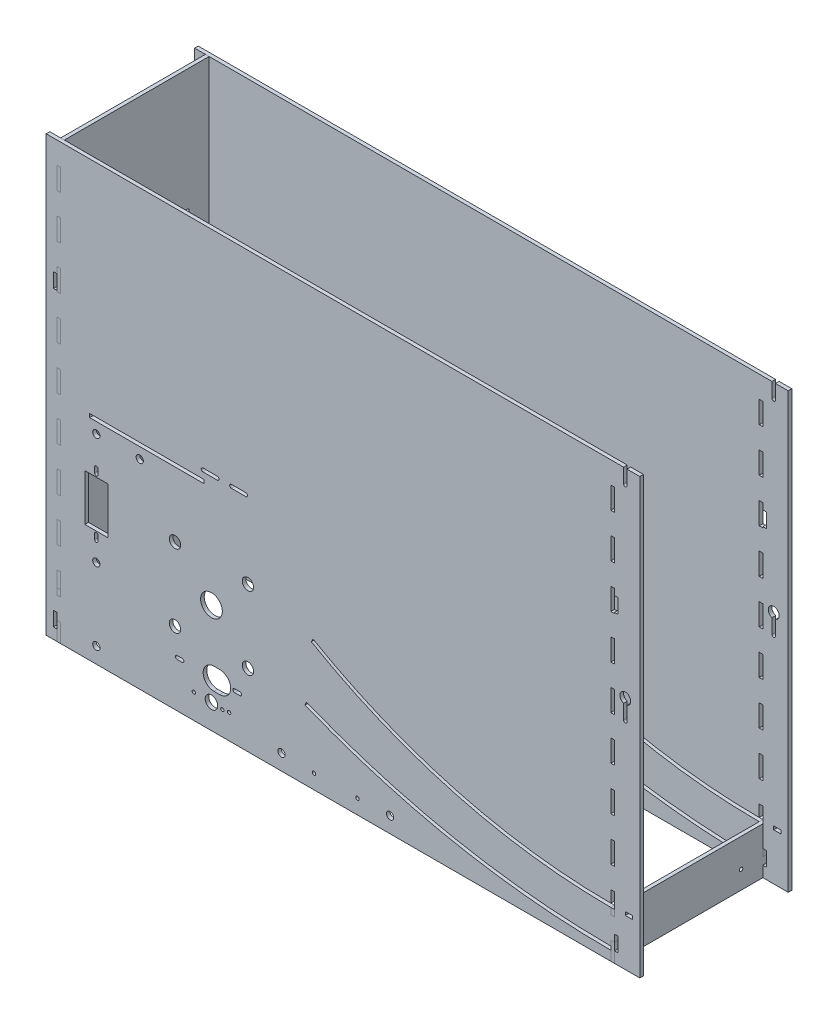
from build123d import *

# Parameters (mm, degrees)
SKETCH1_W                      = 488.95
SKETCH1_H                      = 133.35
SKETCH1_W_2                    = 482.6
SKETCH1_H_2                    = 127
BASE_EXTRUDE_DEPTH             = 3.175
SKETCH1_3_W                    = 488.95
SKETCH1_3_H                    = 133.35
SKETCH1_3_W_2                  = 482.6
SKETCH1_3_H_2                  = 127
WALL_EXTRUDE_DEPTH             = 384.175
WHEELRAMP7_W                   = 100.522513305
WHEELRAMP7_H                   = 3.175
WHEELRAMP7_R                   = 9.525
WHEELRAMP7_R_2                 = 5
CUT_EXTRUDE6_DEPTH             = 475.489914276
WHEELRAMP7_3_W                 = 20.2
WHEELRAMP7_3_H                 = 40.9
BRAKE_PAD_SERVO_CUT_DEPTH      = 475.489914276
WHEELRAMP7_4_R                 = 1.5
RATCHET_BRAKE_SERVO_CUT_DEPTH  = 475.489914276
WHEELRAMP7_5_R                 = 5.5
WHEELRAMP7_5_R_2               = 1.5
SOLENOIDBRAKE_DEPTH            = 475.489914276
SKETCH19_W                     = 25.4
SKETCH19_H                     = 3.175
SKETCH19_R                     = 3.175
SKETCH19_R_2                   = 5.5
SKETCH19_R_3                   = 1.5
SIDE_CUTS_DEPTH                = 626.386351586
SKETCH23_W                     = 6.35
SKETCH23_H                     = 2.9972
SKETCH23_W_2                   = 9.525
SKETCH23_H_2                   = 384.175
BOSS_EXTRUDE1_DEPTH            = 3.175
BOSS_EXTRUDE2_START            = -130.175
SKETCH23_2_W                   = 6.35
SKETCH23_2_H                   = 2.9972
SKETCH23_2_W_2                 = 9.525
SKETCH23_2_H_2                 = 384.175
BOSS_EXTRUDE2_DEPTH            = 3.175
SKETCH21_W                     = 12.827
SKETCH21_H                     = 6.477
SKETCH21_W_2                   = 6.477
SKETCH21_H_2                   = 12.827
SKETCH21_W_3                   = 3.175
BOTTOM_SUPPORT_HOLES_DEPTH     = 473.403298306
SPLIT1_START                   = -63.5
SPLIT1_OUTLINE_W               = 3.175
SPLIT1_OUTLINE_H               = 40.973335237
SPLIT1_DEPTH                   = 127
SPLIT1_START_2                 = -66.675
SPLIT1_2_OUTLINE_W             = 3.175
SPLIT1_2_OUTLINE_H             = 16.03375
SPLIT1_2_OUTLINE_H_2           = 5.730835237
SPLIT1_2_DEPTH                 = 133.35
SPLIT1_3_OUTLINE_W             = 3.175
SPLIT1_3_OUTLINE_H             = 3.175
SPLIT1_3_DEPTH                 = 12.122727273
SPLIT1_START_3                 = -42.429545455
SPLIT1_4_OUTLINE_W             = 3.175
SPLIT1_4_OUTLINE_H             = 3.175
SPLIT1_4_DEPTH                 = 12.122727273
SPLIT1_START_4                 = -18.184090909
SPLIT1_5_OUTLINE_W             = 3.175
SPLIT1_5_OUTLINE_H             = 3.175
SPLIT1_5_DEPTH                 = 12.122727273
SPLIT1_START_5                 = 6.061363636
SPLIT1_6_OUTLINE_W             = 3.175
SPLIT1_6_OUTLINE_H             = 3.175
SPLIT1_6_DEPTH                 = 12.122727273
SPLIT1_START_6                 = 30.306818182
SPLIT1_7_OUTLINE_W             = 3.175
SPLIT1_7_OUTLINE_H             = 3.175
SPLIT1_7_DEPTH                 = 12.122727273
SPLIT1_START_7                 = 54.552272727
SPLIT1_8_OUTLINE_W             = 3.175
SPLIT1_8_OUTLINE_H             = 3.175
SPLIT1_8_DEPTH                 = 12.122727273
SPLIT1_START_8                 = -244.475
SPLIT1_9_OUTLINE_R             = 1.5
SPLIT1_9_OUTLINE_R_2           = 5.5
SPLIT1_9_OUTLINE_W             = 3.175
SPLIT1_9_OUTLINE_H             = 25.4
SPLIT1_9_OUTLINE_R_3           = 3.175
SPLIT1_9_DEPTH                 = 3.175
SPLIT1_START_9                 = 3.175
SPLIT1_10_OUTLINE_W            = 3.175
SPLIT1_10_OUTLINE_H            = 127
SPLIT1_10_DEPTH                = 381
SPLIT1_11_OUTLINE_W            = 3.175
SPLIT1_11_OUTLINE_H            = 12.122727273
SPLIT1_11_DEPTH                = 19.20875
SPLIT1_START_10                = 38.4175
SPLIT1_12_OUTLINE_W            = 3.175
SPLIT1_12_OUTLINE_H            = 3.175
SPLIT1_12_DEPTH                = 19.20875
SPLIT1_START_11                = 76.835
SPLIT1_13_OUTLINE_W            = 3.175
SPLIT1_13_OUTLINE_H            = 3.175
SPLIT1_13_DEPTH                = 19.20875
SPLIT1_START_12                = 115.2525
SPLIT1_14_OUTLINE_W            = 3.175
SPLIT1_14_OUTLINE_H            = 3.175
SPLIT1_14_DEPTH                = 19.20875
SPLIT1_START_13                = 153.67
SPLIT1_15_OUTLINE_W            = 3.175
SPLIT1_15_OUTLINE_H            = 3.175
SPLIT1_15_DEPTH                = 19.20875
SPLIT1_START_14                = 192.0875
SPLIT1_16_OUTLINE_W            = 3.175
SPLIT1_16_OUTLINE_H            = 3.175
SPLIT1_16_DEPTH                = 19.20875
SPLIT1_START_15                = 230.505
SPLIT1_17_OUTLINE_W            = 3.175
SPLIT1_17_OUTLINE_H            = 3.175
SPLIT1_17_DEPTH                = 19.20875
SPLIT1_START_16                = 268.9225
SPLIT1_18_OUTLINE_W            = 3.175
SPLIT1_18_OUTLINE_H            = 3.175
SPLIT1_18_DEPTH                = 19.20875
SPLIT1_START_17                = 307.34
SPLIT1_19_OUTLINE_W            = 3.175
SPLIT1_19_OUTLINE_H            = 3.175
SPLIT1_19_DEPTH                = 19.20875
SPLIT1_START_18                = 345.7575
SPLIT1_20_OUTLINE_W            = 3.175
SPLIT1_20_OUTLINE_H            = 3.175
SPLIT1_20_DEPTH                = 19.20875
SPLIT2_START                   = -63.5
SPLIT2_OUTLINE_W               = 3.175
SPLIT2_OUTLINE_H               = 40.973335237
SPLIT2_DEPTH                   = 127
SPLIT2_START_2                 = -66.675
SPLIT2_2_OUTLINE_W             = 3.175
SPLIT2_2_OUTLINE_H             = 16.03375
SPLIT2_2_OUTLINE_H_2           = 5.730835237
SPLIT2_2_DEPTH                 = 133.35
SPLIT2_3_OUTLINE_W             = 3.175
SPLIT2_3_OUTLINE_H             = 3.175
SPLIT2_3_DEPTH                 = 12.122727273
SPLIT2_START_3                 = -42.429545455
SPLIT2_4_OUTLINE_W             = 3.175
SPLIT2_4_OUTLINE_H             = 3.175
SPLIT2_4_DEPTH                 = 12.122727273
SPLIT2_START_4                 = -18.184090909
SPLIT2_5_OUTLINE_W             = 3.175
SPLIT2_5_OUTLINE_H             = 3.175
SPLIT2_5_DEPTH                 = 12.122727273
SPLIT2_START_5                 = 6.061363636
SPLIT2_6_OUTLINE_W             = 3.175
SPLIT2_6_OUTLINE_H             = 3.175
SPLIT2_6_DEPTH                 = 12.122727273
SPLIT2_START_6                 = 30.306818182
SPLIT2_7_OUTLINE_W             = 3.175
SPLIT2_7_OUTLINE_H             = 3.175
SPLIT2_7_DEPTH                 = 12.122727273
SPLIT2_START_7                 = 54.552272727
SPLIT2_8_OUTLINE_W             = 3.175
SPLIT2_8_OUTLINE_H             = 3.175
SPLIT2_8_DEPTH                 = 12.122727273
SPLIT2_START_8                 = 3.175
SPLIT2_9_OUTLINE_W             = 3.175
SPLIT2_9_OUTLINE_H             = 127
SPLIT2_9_DEPTH                 = 381
SPLIT2_10_OUTLINE_W            = 3.175
SPLIT2_10_OUTLINE_H            = 12.122727273
SPLIT2_10_DEPTH                = 19.20875
SPLIT2_START_9                 = 38.4175
SPLIT2_11_OUTLINE_W            = 3.175
SPLIT2_11_OUTLINE_H            = 3.175
SPLIT2_11_DEPTH                = 19.20875
SPLIT2_START_10                = 76.835
SPLIT2_12_OUTLINE_W            = 3.175
SPLIT2_12_OUTLINE_H            = 3.175
SPLIT2_12_DEPTH                = 19.20875
SPLIT2_START_11                = 115.2525
SPLIT2_13_OUTLINE_W            = 3.175
SPLIT2_13_OUTLINE_H            = 3.175
SPLIT2_13_DEPTH                = 19.20875
SPLIT2_START_12                = 153.67
SPLIT2_14_OUTLINE_W            = 3.175
SPLIT2_14_OUTLINE_H            = 3.175
SPLIT2_14_DEPTH                = 19.20875
SPLIT2_START_13                = 192.0875
SPLIT2_15_OUTLINE_W            = 3.175
SPLIT2_15_OUTLINE_H            = 3.175
SPLIT2_15_DEPTH                = 19.20875
SPLIT2_START_14                = 230.505
SPLIT2_16_OUTLINE_W            = 3.175
SPLIT2_16_OUTLINE_H            = 3.175
SPLIT2_16_DEPTH                = 19.20875
SPLIT2_START_15                = 268.9225
SPLIT2_17_OUTLINE_W            = 3.175
SPLIT2_17_OUTLINE_H            = 3.175
SPLIT2_17_DEPTH                = 19.20875
SPLIT2_START_16                = 307.34
SPLIT2_18_OUTLINE_W            = 3.175
SPLIT2_18_OUTLINE_H            = 3.175
SPLIT2_18_DEPTH                = 19.20875
SPLIT2_START_17                = 345.7575
SPLIT2_19_OUTLINE_W            = 3.175
SPLIT2_19_OUTLINE_H            = 3.175
SPLIT2_19_DEPTH                = 19.20875
SPLIT2_START_18                = 241.3
SPLIT2_20_OUTLINE_R            = 1.5
SPLIT2_20_OUTLINE_R_2          = 5.5
SPLIT2_20_OUTLINE_W            = 3.175
SPLIT2_20_OUTLINE_H            = 25.4
SPLIT2_20_OUTLINE_R_3          = 3.175
SPLIT2_20_DEPTH                = 3.175
SKETCH22_W                     = 520.7
SKETCH22_H                     = 3.175
CUT_EXTRUDE5_DEPTH             = 487.314243185
SKETCH26_R                     = 1.5
SKETCH26_W                     = 3.175
SKETCH26_H                     = 12.7
FRONT_BACK_SUPPORT_HOLES_DEPTH = 487.314243185
SKETCH27_R                     = 1.5
SIDE_SUPPORT_HOLES_DEPTH       = 643.9120211
SHORTSIDECUT_START             = -3.175
SHORTSIDECUT_OUTLINE_R         = 1.5
SHORTSIDECUT_OUTLINE_R_2       = 5.5
SHORTSIDECUT_OUTLINE_W         = 25.4
SHORTSIDECUT_OUTLINE_H         = 3.175
SHORTSIDECUT_OUTLINE_R_3       = 3.175
SHORTSIDECUT_DEPTH             = 3.175
WHEELRAMP7_6_R                 = 3.175
WIREHOLECUT_DEPTH              = 487.314243185


# Read off the part's stored shape, not the designer's step: Split1, Split2, ShortSideCut
with BuildPart() as part:
    # Sketch1 → Base Extrude (new body)
    # profile 1 of 2: a face of its own
    with BuildSketch(Plane(origin=(0, 0, 0), x_dir=(1, 0, 0), z_dir=(0, 1, 0))):
        Rectangle(SKETCH1_W, SKETCH1_H)
        Rectangle(SKETCH1_W_2, SKETCH1_H_2, mode=Mode.SUBTRACT)
    # profile 2 of 2: a face of its own
    with BuildSketch(Plane(origin=(0, 0, 0), x_dir=(1, 0, 0), z_dir=(0, 1, 0))):
        Rectangle(SKETCH1_W_2, SKETCH1_H_2)
    extrude(amount=BASE_EXTRUDE_DEPTH)

    # Sketch1<3> → Wall Extrude (add)
    with BuildSketch(Plane(origin=(0, 0, 0), x_dir=(1, 0, 0), z_dir=(0, 1, 0))):
        Rectangle(SKETCH1_3_W, SKETCH1_3_H)
        Rectangle(SKETCH1_3_W_2, SKETCH1_3_H_2, mode=Mode.SUBTRACT)
    extrude(amount=WALL_EXTRUDE_DEPTH)

    # WheelRamp7 → Cut-Extrude6 (cut, through all)
    with BuildSketch(Plane.XY.offset(66.675)):
        with BuildLine():
            Line((-19.862553934, 117.301630657), (-21.450053934, 114.552))
            ThreePointArc((-21.450053934, 114.552), (105.29056388, 62.054317198), (241.3, 44.148335237))
            Line((241.3, 44.148335237), (241.3, 47.323335237))
            ThreePointArc((241.3, 47.323335237), (106.112314349, 65.121131696), (-19.862553934, 117.301630657))
        make_face()
        with Locations((-165.638743347, 189.1665)):
            Rectangle(WHEELRAMP7_W, WHEELRAMP7_H)
        with BuildLine():
            Line((-103.827486695, 199.079), (-116.527486695, 199.079))
            ThreePointArc((-116.527486695, 199.079), (-118.027486695, 197.579), (-116.527486695, 196.079))
            Line((-116.527486695, 196.079), (-103.827486695, 196.079))
            ThreePointArc((-103.827486695, 196.079), (-102.327486695, 197.579), (-103.827486695, 199.079))
        make_face()
        with BuildLine():
            Line((-78.827486695, 199.079), (-91.527486695, 199.079))
            ThreePointArc((-91.527486695, 199.079), (-93.027486695, 197.579), (-91.527486695, 196.079))
            Line((-91.527486695, 196.079), (-78.827486695, 196.079))
            ThreePointArc((-78.827486695, 196.079), (-77.327486695, 197.579), (-78.827486695, 199.079))
        make_face()
        with BuildLine():
            Line((-25.734108325, 66.638172527), (-26.923484259, 63.694363788))
            ThreePointArc((-26.923484259, 63.694363788), (104.678129303, 24.712189892), (241.3, 11.557))
            Line((241.3, 11.557), (241.3, 14.732))
            ThreePointArc((241.3, 14.732), (105.283947863, 27.8288562), (-25.734108325, 66.638172527))
        make_face()
        with Locations((-109.027486695, 98.552)):
            Circle(WHEELRAMP7_R)
        with Locations((-141.027486695, 130.552)):
            Circle(WHEELRAMP7_R_2)
        with Locations((-77.027486695, 130.552)):
            Circle(WHEELRAMP7_R_2)
        with Locations((-141.027486695, 66.552)):
            Circle(WHEELRAMP7_R_2)
        with Locations((-77.027486695, 66.552)):
            Circle(WHEELRAMP7_R_2)
    extrude(amount=-CUT_EXTRUDE6_DEPTH, mode=Mode.SUBTRACT)

    # WheelRamp7<3> → Brake Pad Servo Cut (cut, through all)
    with BuildSketch(Plane.XY.offset(66.675)):
        with Locations((-210.035686695, 124.7948)):
            Rectangle(WHEELRAMP7_3_W, WHEELRAMP7_3_H)
        with BuildLine():
            Line((-211.535686695, 101.7948), (-211.535686695, 97.2948))
            ThreePointArc((-211.535686695, 97.2948), (-210.035686695, 95.7948), (-208.535686695, 97.2948))
            Line((-208.535686695, 97.2948), (-208.535686695, 101.7948))
            ThreePointArc((-208.535686695, 101.7948), (-210.035686695, 103.2948), (-211.535686695, 101.7948))
        make_face()
        with BuildLine():
            Line((-208.535686695, 147.7948), (-208.535686695, 152.2948))
            ThreePointArc((-208.535686695, 152.2948), (-210.035686695, 153.7948), (-211.535686695, 152.2948))
            Line((-211.535686695, 152.2948), (-211.535686695, 147.7948))
            ThreePointArc((-211.535686695, 147.7948), (-210.035686695, 146.2948), (-208.535686695, 147.7948))
        make_face()
    extrude(amount=-BRAKE_PAD_SERVO_CUT_DEPTH, mode=Mode.SUBTRACT)

    # WheelRamp7<4> → Ratchet Brake Servo Cut (cut, through all)
    with BuildSketch(Plane.XY.offset(66.675)):
        with Locations((-99.502486695, 24.0114074)):
            Circle(WHEELRAMP7_4_R)
        with BuildLine():
            Line((-101.697486695, 34.227), (-106.777486695, 34.227))
            ThreePointArc((-106.777486695, 34.227), (-116.302486695, 43.752), (-106.777486695, 53.277))
            Line((-106.777486695, 53.277), (-101.697486695, 53.277))
            ThreePointArc((-101.697486695, 53.277), (-92.172486695, 43.752), (-101.697486695, 34.227))
        make_face()
        with BuildLine():
            Line((-139.187486695, 45.252), (-134.687486695, 45.252))
            ThreePointArc((-134.687486695, 45.252), (-133.187486695, 43.752), (-134.687486695, 42.252))
            Line((-134.687486695, 42.252), (-139.187486695, 42.252))
            ThreePointArc((-139.187486695, 42.252), (-140.687486695, 43.752), (-139.187486695, 45.252))
        make_face()
        with BuildLine():
            Line((-84.187486695, 42.252), (-88.687486695, 42.252))
            ThreePointArc((-88.687486695, 42.252), (-90.187486695, 43.752), (-88.687486695, 45.252))
            Line((-88.687486695, 45.252), (-84.187486695, 45.252))
            ThreePointArc((-84.187486695, 45.252), (-82.687486695, 43.752), (-84.187486695, 42.252))
        make_face()
    extrude(amount=-RATCHET_BRAKE_SERVO_CUT_DEPTH, mode=Mode.SUBTRACT)

    # WheelRamp7<5> → SolenoidBrake (cut, through all)
    with BuildSketch(Plane.XY.offset(66.675)):
        with Locations((-109.027486695, 24.765)):
            Circle(WHEELRAMP7_5_R)
        with Locations((-124.527486695, 24.765)):
            Circle(WHEELRAMP7_5_R_2)
        with Locations((-93.527486695, 24.765)):
            Circle(WHEELRAMP7_5_R_2)
    extrude(amount=-SOLENOIDBRAKE_DEPTH, mode=Mode.SUBTRACT)

    # Sketch19 → Side Cuts (cut, through all)
    with BuildSketch(Plane.ZY.offset(244.475)):
        with Locations((0, 189.1665)):
            Rectangle(SKETCH19_W, SKETCH19_H)
        with Locations((0, 204.216)):
            Circle(SKETCH19_R)
        with Locations((0, 98.552)):
            Circle(SKETCH19_R_2)
        with Locations((-15.5, 98.552)):
            Circle(SKETCH19_R_3)
        with Locations((15.5, 98.552)):
            Circle(SKETCH19_R_3)
    extrude(amount=-SIDE_CUTS_DEPTH, mode=Mode.SUBTRACT)

    # Sketch23 → Boss-Extrude1 (add)
    # profile 1 of 2: a face of its own
    with BuildSketch(Plane.XY.offset(66.675)):
        with BuildLine():
            Line((252.5, 384.175), (244.475, 384.175))
            Line((244.475, 384.175), (244.475, 0))
            Line((244.475, 0), (266.7, 0))
            Line((266.7, 0), (266.7, 384.175))
            Line((266.7, 384.175), (255.5, 384.175))
            Line((255.5, 384.175), (255.5, 371.475))
            ThreePointArc((255.5, 371.475), (254, 369.975), (252.5, 371.475))
            Line((252.5, 371.475), (252.5, 384.175))
        make_face()
        with Locations((257.175, 45.824735237)):
            Rectangle(SKETCH23_W, SKETCH23_H, mode=Mode.SUBTRACT)
        with BuildLine():
            Line((252.5, 192.0875), (252.5, 204.7875))
            ThreePointArc((252.5, 204.7875), (251.212738239, 213.169292048), (258.7625, 209.307611309))
            ThreePointArc((258.7625, 209.307611309), (257.861680738, 206.520349548), (255.5, 204.7875))
            Line((255.5, 204.7875), (255.5, 192.0875))
            ThreePointArc((255.5, 192.0875), (254, 190.5875), (252.5, 192.0875))
        make_face(mode=Mode.SUBTRACT)
    # profile 2 of 2: a face of its own
    with BuildSketch(Plane.XY.offset(66.675)):
        with Locations((-249.2375, 192.0875)):
            Rectangle(SKETCH23_W_2, SKETCH23_H_2)
    extrude(amount=-BOSS_EXTRUDE1_DEPTH)

    # Sketch23<2> → Boss-Extrude2 (add)
    # profile 1 of 2: a face of its own
    with BuildSketch(Plane.XY.offset(66.675).offset(BOSS_EXTRUDE2_START)):
        with BuildLine():
            Line((252.5, 384.175), (244.475, 384.175))
            Line((244.475, 384.175), (244.475, 0))
            Line((244.475, 0), (266.7, 0))
            Line((266.7, 0), (266.7, 384.175))
            Line((266.7, 384.175), (255.5, 384.175))
            Line((255.5, 384.175), (255.5, 371.475))
            ThreePointArc((255.5, 371.475), (254, 369.975), (252.5, 371.475))
            Line((252.5, 371.475), (252.5, 384.175))
        make_face()
        with Locations((257.175, 45.824735237)):
            Rectangle(SKETCH23_2_W, SKETCH23_2_H, mode=Mode.SUBTRACT)
        with BuildLine():
            Line((252.5, 192.0875), (252.5, 204.7875))
            ThreePointArc((252.5, 204.7875), (251.212738239, 213.169292048), (258.7625, 209.307611309))
            ThreePointArc((258.7625, 209.307611309), (257.861680738, 206.520349548), (255.5, 204.7875))
            Line((255.5, 204.7875), (255.5, 192.0875))
            ThreePointArc((255.5, 192.0875), (254, 190.5875), (252.5, 192.0875))
        make_face(mode=Mode.SUBTRACT)
    # profile 2 of 2: a face of its own
    with BuildSketch(Plane.XY.offset(66.675).offset(BOSS_EXTRUDE2_START)):
        with Locations((-249.2375, 192.0875)):
            Rectangle(SKETCH23_2_W_2, SKETCH23_2_H_2)
    extrude(amount=-BOSS_EXTRUDE2_DEPTH)

    # Sketch21 → Bottom Support Holes (cut, through all)
    with BuildSketch(Plane.XZ):
        with Locations((0, 50.7365)):
            Rectangle(SKETCH21_W, SKETCH21_H)
        with Locations((-228.5365, 0)):
            Rectangle(SKETCH21_W_2, SKETCH21_H_2)
        with Locations((0, -50.7365)):
            Rectangle(SKETCH21_W, SKETCH21_H)
        with Locations((230.1875, 0)):
            Rectangle(SKETCH21_W_3, SKETCH21_H_2)
    extrude(amount=-BOTTOM_SUPPORT_HOLES_DEPTH, mode=Mode.SUBTRACT)

    # Split1 10 outline → Split1 10 (cut)
    with BuildSketch(Plane(origin=(0, 0, 0), x_dir=(1, 0, 0), z_dir=(0, 1, 0)).offset(SPLIT1_START_9)):
        with Locations((-242.8875, 0)):
            Rectangle(SPLIT1_10_OUTLINE_W, SPLIT1_10_OUTLINE_H)
    extrude(amount=SPLIT1_10_DEPTH, mode=Mode.SUBTRACT)

    # Split1 11 outline → Split1 11 (cut)
    with BuildSketch(Plane(origin=(0, 0, 0), x_dir=(1, 0, 0), z_dir=(0, 1, 0))):
        with Locations((-242.8875, 60.613636363)):
            Rectangle(SPLIT1_11_OUTLINE_W, SPLIT1_11_OUTLINE_H)
        with Locations((-242.8875, 36.368181819)):
            Rectangle(SPLIT1_11_OUTLINE_W, SPLIT1_11_OUTLINE_H)
        with Locations((-242.8875, 12.122727273)):
            Rectangle(SPLIT1_11_OUTLINE_W, SPLIT1_11_OUTLINE_H)
        with Locations((-242.8875, -12.122727273)):
            Rectangle(SPLIT1_11_OUTLINE_W, SPLIT1_11_OUTLINE_H)
        with Locations((-242.8875, -36.368181819)):
            Rectangle(SPLIT1_11_OUTLINE_W, SPLIT1_11_OUTLINE_H)
        with Locations((-242.8875, -60.613636363)):
            Rectangle(SPLIT1_11_OUTLINE_W, SPLIT1_11_OUTLINE_H)
    extrude(amount=SPLIT1_11_DEPTH, mode=Mode.SUBTRACT)

    # Split1 12 outline → Split1 12 (cut)
    with BuildSketch(Plane(origin=(0, 0, 0), x_dir=(1, 0, 0), z_dir=(0, 1, 0)).offset(SPLIT1_START_10)):
        with Locations((-242.8875, 65.0875)):
            Rectangle(SPLIT1_12_OUTLINE_W, SPLIT1_12_OUTLINE_H)
        with Locations((-242.8875, -65.0875)):
            Rectangle(SPLIT1_12_OUTLINE_W, SPLIT1_12_OUTLINE_H)
    extrude(amount=SPLIT1_12_DEPTH, mode=Mode.SUBTRACT)

    # Split1 13 outline → Split1 13 (cut)
    with BuildSketch(Plane(origin=(0, 0, 0), x_dir=(1, 0, 0), z_dir=(0, 1, 0)).offset(SPLIT1_START_11)):
        with Locations((-242.8875, 65.0875)):
            Rectangle(SPLIT1_13_OUTLINE_W, SPLIT1_13_OUTLINE_H)
        with Locations((-242.8875, -65.0875)):
            Rectangle(SPLIT1_13_OUTLINE_W, SPLIT1_13_OUTLINE_H)
    extrude(amount=SPLIT1_13_DEPTH, mode=Mode.SUBTRACT)

    # Split1 14 outline → Split1 14 (cut)
    with BuildSketch(Plane(origin=(0, 0, 0), x_dir=(1, 0, 0), z_dir=(0, 1, 0)).offset(SPLIT1_START_12)):
        with Locations((-242.8875, 65.0875)):
            Rectangle(SPLIT1_14_OUTLINE_W, SPLIT1_14_OUTLINE_H)
        with Locations((-242.8875, -65.0875)):
            Rectangle(SPLIT1_14_OUTLINE_W, SPLIT1_14_OUTLINE_H)
    extrude(amount=SPLIT1_14_DEPTH, mode=Mode.SUBTRACT)

    # Split1 15 outline → Split1 15 (cut)
    with BuildSketch(Plane(origin=(0, 0, 0), x_dir=(1, 0, 0), z_dir=(0, 1, 0)).offset(SPLIT1_START_13)):
        with Locations((-242.8875, 65.0875)):
            Rectangle(SPLIT1_15_OUTLINE_W, SPLIT1_15_OUTLINE_H)
        with Locations((-242.8875, -65.0875)):
            Rectangle(SPLIT1_15_OUTLINE_W, SPLIT1_15_OUTLINE_H)
    extrude(amount=SPLIT1_15_DEPTH, mode=Mode.SUBTRACT)

    # Split1 16 outline → Split1 16 (cut)
    with BuildSketch(Plane(origin=(0, 0, 0), x_dir=(1, 0, 0), z_dir=(0, 1, 0)).offset(SPLIT1_START_14)):
        with Locations((-242.8875, 65.0875)):
            Rectangle(SPLIT1_16_OUTLINE_W, SPLIT1_16_OUTLINE_H)
        with Locations((-242.8875, -65.0875)):
            Rectangle(SPLIT1_16_OUTLINE_W, SPLIT1_16_OUTLINE_H)
    extrude(amount=SPLIT1_16_DEPTH, mode=Mode.SUBTRACT)

    # Split1 17 outline → Split1 17 (cut)
    with BuildSketch(Plane(origin=(0, 0, 0), x_dir=(1, 0, 0), z_dir=(0, 1, 0)).offset(SPLIT1_START_15)):
        with Locations((-242.8875, 65.0875)):
            Rectangle(SPLIT1_17_OUTLINE_W, SPLIT1_17_OUTLINE_H)
        with Locations((-242.8875, -65.0875)):
            Rectangle(SPLIT1_17_OUTLINE_W, SPLIT1_17_OUTLINE_H)
    extrude(amount=SPLIT1_17_DEPTH, mode=Mode.SUBTRACT)

    # Split1 18 outline → Split1 18 (cut)
    with BuildSketch(Plane(origin=(0, 0, 0), x_dir=(1, 0, 0), z_dir=(0, 1, 0)).offset(SPLIT1_START_16)):
        with Locations((-242.8875, 65.0875)):
            Rectangle(SPLIT1_18_OUTLINE_W, SPLIT1_18_OUTLINE_H)
        with Locations((-242.8875, -65.0875)):
            Rectangle(SPLIT1_18_OUTLINE_W, SPLIT1_18_OUTLINE_H)
    extrude(amount=SPLIT1_18_DEPTH, mode=Mode.SUBTRACT)

    # Split1 19 outline → Split1 19 (cut)
    with BuildSketch(Plane(origin=(0, 0, 0), x_dir=(1, 0, 0), z_dir=(0, 1, 0)).offset(SPLIT1_START_17)):
        with Locations((-242.8875, 65.0875)):
            Rectangle(SPLIT1_19_OUTLINE_W, SPLIT1_19_OUTLINE_H)
        with Locations((-242.8875, -65.0875)):
            Rectangle(SPLIT1_19_OUTLINE_W, SPLIT1_19_OUTLINE_H)
    extrude(amount=SPLIT1_19_DEPTH, mode=Mode.SUBTRACT)

    # Split1 20 outline → Split1 20 (cut)
    with BuildSketch(Plane(origin=(0, 0, 0), x_dir=(1, 0, 0), z_dir=(0, 1, 0)).offset(SPLIT1_START_18)):
        with Locations((-242.8875, 65.0875)):
            Rectangle(SPLIT1_20_OUTLINE_W, SPLIT1_20_OUTLINE_H)
        with Locations((-242.8875, -65.0875)):
            Rectangle(SPLIT1_20_OUTLINE_W, SPLIT1_20_OUTLINE_H)
    extrude(amount=SPLIT1_20_DEPTH, mode=Mode.SUBTRACT)

    # Split2 9 outline → Split2 9 (cut)
    with BuildSketch(Plane(origin=(0, 0, 0), x_dir=(1, 0, 0), z_dir=(0, 1, 0)).offset(SPLIT2_START_8)):
        with Locations((242.8875, 0)):
            Rectangle(SPLIT2_9_OUTLINE_W, SPLIT2_9_OUTLINE_H)
    extrude(amount=SPLIT2_9_DEPTH, mode=Mode.SUBTRACT)

    # Split2 10 outline → Split2 10 (cut)
    with BuildSketch(Plane(origin=(0, 0, 0), x_dir=(1, 0, 0), z_dir=(0, 1, 0))):
        with Locations((242.8875, 60.613636363)):
            Rectangle(SPLIT2_10_OUTLINE_W, SPLIT2_10_OUTLINE_H)
        with Locations((242.8875, 36.368181819)):
            Rectangle(SPLIT2_10_OUTLINE_W, SPLIT2_10_OUTLINE_H)
        with Locations((242.8875, 12.122727273)):
            Rectangle(SPLIT2_10_OUTLINE_W, SPLIT2_10_OUTLINE_H)
        with Locations((242.8875, -12.122727273)):
            Rectangle(SPLIT2_10_OUTLINE_W, SPLIT2_10_OUTLINE_H)
        with Locations((242.8875, -36.368181819)):
            Rectangle(SPLIT2_10_OUTLINE_W, SPLIT2_10_OUTLINE_H)
        with Locations((242.8875, -60.613636363)):
            Rectangle(SPLIT2_10_OUTLINE_W, SPLIT2_10_OUTLINE_H)
    extrude(amount=SPLIT2_10_DEPTH, mode=Mode.SUBTRACT)

    # Split2 11 outline → Split2 11 (cut)
    with BuildSketch(Plane(origin=(0, 0, 0), x_dir=(1, 0, 0), z_dir=(0, 1, 0)).offset(SPLIT2_START_9)):
        with Locations((242.8875, 65.0875)):
            Rectangle(SPLIT2_11_OUTLINE_W, SPLIT2_11_OUTLINE_H)
        with Locations((242.8875, -65.0875)):
            Rectangle(SPLIT2_11_OUTLINE_W, SPLIT2_11_OUTLINE_H)
    extrude(amount=SPLIT2_11_DEPTH, mode=Mode.SUBTRACT)

    # Split2 12 outline → Split2 12 (cut)
    with BuildSketch(Plane(origin=(0, 0, 0), x_dir=(1, 0, 0), z_dir=(0, 1, 0)).offset(SPLIT2_START_10)):
        with Locations((242.8875, 65.0875)):
            Rectangle(SPLIT2_12_OUTLINE_W, SPLIT2_12_OUTLINE_H)
        with Locations((242.8875, -65.0875)):
            Rectangle(SPLIT2_12_OUTLINE_W, SPLIT2_12_OUTLINE_H)
    extrude(amount=SPLIT2_12_DEPTH, mode=Mode.SUBTRACT)

    # Split2 13 outline → Split2 13 (cut)
    with BuildSketch(Plane(origin=(0, 0, 0), x_dir=(1, 0, 0), z_dir=(0, 1, 0)).offset(SPLIT2_START_11)):
        with Locations((242.8875, 65.0875)):
            Rectangle(SPLIT2_13_OUTLINE_W, SPLIT2_13_OUTLINE_H)
        with Locations((242.8875, -65.0875)):
            Rectangle(SPLIT2_13_OUTLINE_W, SPLIT2_13_OUTLINE_H)
    extrude(amount=SPLIT2_13_DEPTH, mode=Mode.SUBTRACT)

    # Split2 14 outline → Split2 14 (cut)
    with BuildSketch(Plane(origin=(0, 0, 0), x_dir=(1, 0, 0), z_dir=(0, 1, 0)).offset(SPLIT2_START_12)):
        with Locations((242.8875, 65.0875)):
            Rectangle(SPLIT2_14_OUTLINE_W, SPLIT2_14_OUTLINE_H)
        with Locations((242.8875, -65.0875)):
            Rectangle(SPLIT2_14_OUTLINE_W, SPLIT2_14_OUTLINE_H)
    extrude(amount=SPLIT2_14_DEPTH, mode=Mode.SUBTRACT)

    # Split2 15 outline → Split2 15 (cut)
    with BuildSketch(Plane(origin=(0, 0, 0), x_dir=(1, 0, 0), z_dir=(0, 1, 0)).offset(SPLIT2_START_13)):
        with Locations((242.8875, 65.0875)):
            Rectangle(SPLIT2_15_OUTLINE_W, SPLIT2_15_OUTLINE_H)
        with Locations((242.8875, -65.0875)):
            Rectangle(SPLIT2_15_OUTLINE_W, SPLIT2_15_OUTLINE_H)
    extrude(amount=SPLIT2_15_DEPTH, mode=Mode.SUBTRACT)

    # Split2 16 outline → Split2 16 (cut)
    with BuildSketch(Plane(origin=(0, 0, 0), x_dir=(1, 0, 0), z_dir=(0, 1, 0)).offset(SPLIT2_START_14)):
        with Locations((242.8875, 65.0875)):
            Rectangle(SPLIT2_16_OUTLINE_W, SPLIT2_16_OUTLINE_H)
        with Locations((242.8875, -65.0875)):
            Rectangle(SPLIT2_16_OUTLINE_W, SPLIT2_16_OUTLINE_H)
    extrude(amount=SPLIT2_16_DEPTH, mode=Mode.SUBTRACT)

    # Split2 17 outline → Split2 17 (cut)
    with BuildSketch(Plane(origin=(0, 0, 0), x_dir=(1, 0, 0), z_dir=(0, 1, 0)).offset(SPLIT2_START_15)):
        with Locations((242.8875, 65.0875)):
            Rectangle(SPLIT2_17_OUTLINE_W, SPLIT2_17_OUTLINE_H)
        with Locations((242.8875, -65.0875)):
            Rectangle(SPLIT2_17_OUTLINE_W, SPLIT2_17_OUTLINE_H)
    extrude(amount=SPLIT2_17_DEPTH, mode=Mode.SUBTRACT)

    # Split2 18 outline → Split2 18 (cut)
    with BuildSketch(Plane(origin=(0, 0, 0), x_dir=(1, 0, 0), z_dir=(0, 1, 0)).offset(SPLIT2_START_16)):
        with Locations((242.8875, 65.0875)):
            Rectangle(SPLIT2_18_OUTLINE_W, SPLIT2_18_OUTLINE_H)
        with Locations((242.8875, -65.0875)):
            Rectangle(SPLIT2_18_OUTLINE_W, SPLIT2_18_OUTLINE_H)
    extrude(amount=SPLIT2_18_DEPTH, mode=Mode.SUBTRACT)

    # Split2 19 outline → Split2 19 (cut)
    with BuildSketch(Plane(origin=(0, 0, 0), x_dir=(1, 0, 0), z_dir=(0, 1, 0)).offset(SPLIT2_START_17)):
        with Locations((242.8875, 65.0875)):
            Rectangle(SPLIT2_19_OUTLINE_W, SPLIT2_19_OUTLINE_H)
        with Locations((242.8875, -65.0875)):
            Rectangle(SPLIT2_19_OUTLINE_W, SPLIT2_19_OUTLINE_H)
    extrude(amount=SPLIT2_19_DEPTH, mode=Mode.SUBTRACT)


with BuildPart() as body_2:
    # Split1 outline → Split1 (new body)
    with BuildSketch(Plane.XY.offset(SPLIT1_START)):
        with Locations((-242.8875, 23.661667619)):
            Rectangle(SPLIT1_OUTLINE_W, SPLIT1_OUTLINE_H)
    extrude(amount=SPLIT1_DEPTH)

    # Split1 2 outline → Split1 2 (add)
    with BuildSketch(Plane.XY.offset(SPLIT1_START_2)):
        with Locations((-242.8875, 11.191875)):
            Rectangle(SPLIT1_2_OUTLINE_W, SPLIT1_2_OUTLINE_H)
        with Locations((-242.8875, 41.282917619)):
            Rectangle(SPLIT1_2_OUTLINE_W, SPLIT1_2_OUTLINE_H_2)
    extrude(amount=SPLIT1_2_DEPTH)

    # Split1 3 outline → Split1 3 (add)
    with BuildSketch(Plane.XY.offset(SPLIT1_START_2)):
        with Locations((-242.8875, 1.5875)):
            Rectangle(SPLIT1_3_OUTLINE_W, SPLIT1_3_OUTLINE_H)
    extrude(amount=SPLIT1_3_DEPTH)

    # Split1 4 outline → Split1 4 (add)
    with BuildSketch(Plane.XY.offset(SPLIT1_START_3)):
        with Locations((-242.8875, 1.5875)):
            Rectangle(SPLIT1_4_OUTLINE_W, SPLIT1_4_OUTLINE_H)
    extrude(amount=SPLIT1_4_DEPTH)

    # Split1 5 outline → Split1 5 (add)
    with BuildSketch(Plane.XY.offset(SPLIT1_START_4)):
        with Locations((-242.8875, 1.5875)):
            Rectangle(SPLIT1_5_OUTLINE_W, SPLIT1_5_OUTLINE_H)
    extrude(amount=SPLIT1_5_DEPTH)

    # Split1 6 outline → Split1 6 (add)
    with BuildSketch(Plane.XY.offset(SPLIT1_START_5)):
        with Locations((-242.8875, 1.5875)):
            Rectangle(SPLIT1_6_OUTLINE_W, SPLIT1_6_OUTLINE_H)
    extrude(amount=SPLIT1_6_DEPTH)

    # Split1 7 outline → Split1 7 (add)
    with BuildSketch(Plane.XY.offset(SPLIT1_START_6)):
        with Locations((-242.8875, 1.5875)):
            Rectangle(SPLIT1_7_OUTLINE_W, SPLIT1_7_OUTLINE_H)
    extrude(amount=SPLIT1_7_DEPTH)

    # Split1 8 outline → Split1 8 (add)
    with BuildSketch(Plane.XY.offset(SPLIT1_START_7)):
        with Locations((-242.8875, 1.5875)):
            Rectangle(SPLIT1_8_OUTLINE_W, SPLIT1_8_OUTLINE_H)
    extrude(amount=SPLIT1_8_DEPTH)


with BuildPart() as body_3:
    # Split1 9 outline → Split1 9 (new body)
    with BuildSketch(Plane.YZ.offset(SPLIT1_START_8)):
        Polygon((364.96625, -63.5), (384.175, -63.5), (384.175, 63.5), (364.96625, 63.5), (364.96625, 66.675), (345.7575, 66.675), (345.7575, 63.5), (326.54875, 63.5), (326.54875, 66.675), (307.34, 66.675), (307.34, 63.5), (288.13125, 63.5), (288.13125, 66.675), (268.9225, 66.675), (268.9225, 63.5), (249.71375, 63.5), (249.71375, 66.675), (230.505, 66.675), (230.505, 63.5), (211.29625, 63.5), (211.29625, 66.675), (192.0875, 66.675), (192.0875, 63.5), (172.87875, 63.5), (172.87875, 66.675), (153.67, 66.675), (153.67, 63.5), (134.46125, 63.5), (134.46125, 66.675), (115.2525, 66.675), (115.2525, 63.5), (96.04375, 63.5), (96.04375, 66.675), (76.835, 66.675), (76.835, 63.5), (57.62625, 63.5), (57.62625, 66.675), (44.148335237, 66.675), (44.148335237, -66.675), (57.62625, -66.675), (57.62625, -63.5), (76.835, -63.5), (76.835, -66.675), (96.04375, -66.675), (96.04375, -63.5), (115.2525, -63.5), (115.2525, -66.675), (134.46125, -66.675), (134.46125, -63.5), (153.67, -63.5), (153.67, -66.675), (172.87875, -66.675), (172.87875, -63.5), (192.0875, -63.5), (192.0875, -66.675), (211.29625, -66.675), (211.29625, -63.5), (230.505, -63.5), (230.505, -66.675), (249.71375, -66.675), (249.71375, -63.5), (268.9225, -63.5), (268.9225, -66.675), (288.13125, -66.675), (288.13125, -63.5), (307.34, -63.5), (307.34, -66.675), (326.54875, -66.675), (326.54875, -63.5), (345.7575, -63.5), (345.7575, -66.675), (364.96625, -66.675), align=None)
        with Locations((98.552, -15.5)):
            Circle(SPLIT1_9_OUTLINE_R, mode=Mode.SUBTRACT)
        with Locations((98.552, 0)):
            Circle(SPLIT1_9_OUTLINE_R_2, mode=Mode.SUBTRACT)
        with Locations((98.552, 15.5)):
            Circle(SPLIT1_9_OUTLINE_R, mode=Mode.SUBTRACT)
        with Locations((189.1665, 0)):
            Rectangle(SPLIT1_9_OUTLINE_W, SPLIT1_9_OUTLINE_H, mode=Mode.SUBTRACT)
        with Locations((204.216, 0)):
            Circle(SPLIT1_9_OUTLINE_R_3, mode=Mode.SUBTRACT)
    extrude(amount=SPLIT1_9_DEPTH)


with BuildPart() as body_4:
    # Split2 outline → Split2 (new body)
    with BuildSketch(Plane.XY.offset(SPLIT2_START)):
        with Locations((242.8875, 23.661667619)):
            Rectangle(SPLIT2_OUTLINE_W, SPLIT2_OUTLINE_H)
    extrude(amount=SPLIT2_DEPTH)

    # Split2 2 outline → Split2 2 (add)
    with BuildSketch(Plane.XY.offset(SPLIT2_START_2)):
        with Locations((242.8875, 11.191875)):
            Rectangle(SPLIT2_2_OUTLINE_W, SPLIT2_2_OUTLINE_H)
        with Locations((242.8875, 41.282917619)):
            Rectangle(SPLIT2_2_OUTLINE_W, SPLIT2_2_OUTLINE_H_2)
    extrude(amount=SPLIT2_2_DEPTH)

    # Split2 3 outline → Split2 3 (add)
    with BuildSketch(Plane.XY.offset(SPLIT2_START_2)):
        with Locations((242.8875, 1.5875)):
            Rectangle(SPLIT2_3_OUTLINE_W, SPLIT2_3_OUTLINE_H)
    extrude(amount=SPLIT2_3_DEPTH)

    # Split2 4 outline → Split2 4 (add)
    with BuildSketch(Plane.XY.offset(SPLIT2_START_3)):
        with Locations((242.8875, 1.5875)):
            Rectangle(SPLIT2_4_OUTLINE_W, SPLIT2_4_OUTLINE_H)
    extrude(amount=SPLIT2_4_DEPTH)

    # Split2 5 outline → Split2 5 (add)
    with BuildSketch(Plane.XY.offset(SPLIT2_START_4)):
        with Locations((242.8875, 1.5875)):
            Rectangle(SPLIT2_5_OUTLINE_W, SPLIT2_5_OUTLINE_H)
    extrude(amount=SPLIT2_5_DEPTH)

    # Split2 6 outline → Split2 6 (add)
    with BuildSketch(Plane.XY.offset(SPLIT2_START_5)):
        with Locations((242.8875, 1.5875)):
            Rectangle(SPLIT2_6_OUTLINE_W, SPLIT2_6_OUTLINE_H)
    extrude(amount=SPLIT2_6_DEPTH)

    # Split2 7 outline → Split2 7 (add)
    with BuildSketch(Plane.XY.offset(SPLIT2_START_6)):
        with Locations((242.8875, 1.5875)):
            Rectangle(SPLIT2_7_OUTLINE_W, SPLIT2_7_OUTLINE_H)
    extrude(amount=SPLIT2_7_DEPTH)

    # Split2 8 outline → Split2 8 (add)
    with BuildSketch(Plane.XY.offset(SPLIT2_START_7)):
        with Locations((242.8875, 1.5875)):
            Rectangle(SPLIT2_8_OUTLINE_W, SPLIT2_8_OUTLINE_H)
    extrude(amount=SPLIT2_8_DEPTH)


with BuildPart() as body_5:
    # Split2 20 outline → Split2 20 (new body)
    with BuildSketch(Plane.YZ.offset(SPLIT2_START_18)):
        Polygon((44.148335237, 66.675), (44.148335237, -66.675), (57.62625, -66.675), (57.62625, -63.5), (76.835, -63.5), (76.835, -66.675), (96.04375, -66.675), (96.04375, -63.5), (115.2525, -63.5), (115.2525, -66.675), (134.46125, -66.675), (134.46125, -63.5), (153.67, -63.5), (153.67, -66.675), (172.87875, -66.675), (172.87875, -63.5), (192.0875, -63.5), (192.0875, -66.675), (211.29625, -66.675), (211.29625, -63.5), (230.505, -63.5), (230.505, -66.675), (249.71375, -66.675), (249.71375, -63.5), (268.9225, -63.5), (268.9225, -66.675), (288.13125, -66.675), (288.13125, -63.5), (307.34, -63.5), (307.34, -66.675), (326.54875, -66.675), (326.54875, -63.5), (345.7575, -63.5), (345.7575, -66.675), (364.96625, -66.675), (364.96625, -63.5), (384.175, -63.5), (384.175, 63.5), (364.96625, 63.5), (364.96625, 66.675), (345.7575, 66.675), (345.7575, 63.5), (326.54875, 63.5), (326.54875, 66.675), (307.34, 66.675), (307.34, 63.5), (288.13125, 63.5), (288.13125, 66.675), (268.9225, 66.675), (268.9225, 63.5), (249.71375, 63.5), (249.71375, 66.675), (230.505, 66.675), (230.505, 63.5), (211.29625, 63.5), (211.29625, 66.675), (192.0875, 66.675), (192.0875, 63.5), (172.87875, 63.5), (172.87875, 66.675), (153.67, 66.675), (153.67, 63.5), (134.46125, 63.5), (134.46125, 66.675), (115.2525, 66.675), (115.2525, 63.5), (96.04375, 63.5), (96.04375, 66.675), (76.835, 66.675), (76.835, 63.5), (57.62625, 63.5), (57.62625, 66.675), align=None)
        with Locations((98.552, -15.5)):
            Circle(SPLIT2_20_OUTLINE_R, mode=Mode.SUBTRACT)
        with Locations((98.552, 0)):
            Circle(SPLIT2_20_OUTLINE_R_2, mode=Mode.SUBTRACT)
        with Locations((98.552, 15.5)):
            Circle(SPLIT2_20_OUTLINE_R, mode=Mode.SUBTRACT)
        with Locations((189.1665, 0)):
            Rectangle(SPLIT2_20_OUTLINE_W, SPLIT2_20_OUTLINE_H, mode=Mode.SUBTRACT)
        with Locations((204.216, 0)):
            Circle(SPLIT2_20_OUTLINE_R_3, mode=Mode.SUBTRACT)
    extrude(amount=SPLIT2_20_DEPTH)


with BuildPart() as cut_extrude5_tool:
    # Sketch22 → Cut-Extrude5 (new, through all)
    with BuildSketch(Plane.XY.offset(66.675)):
        with Locations((6.35, 1.5875)):
            Rectangle(SKETCH22_W, SKETCH22_H)
    extrude(amount=-CUT_EXTRUDE5_DEPTH)


with BuildPart() as part_1:
    add(part.part)

    # Cut-Extrude5: cut by cut_extrude5_tool
    add(cut_extrude5_tool.part, mode=Mode.SUBTRACT)

    # Sketch26 → Front/Back Support Holes (cut, through all)
    with BuildSketch(Plane.XY.offset(66.675)):
        with Locations((-19.05, 15.875)):
            Circle(SKETCH26_R)
        with Locations((19.05, 15.875)):
            Circle(SKETCH26_R)
        with Locations((246.0625, 19.05)):
            Rectangle(SKETCH26_W, SKETCH26_H)
        with Locations((-246.0625, 19.05)):
            Rectangle(SKETCH26_W, SKETCH26_H)
        with Locations((246.0625, 276.225)):
            Rectangle(SKETCH26_W, SKETCH26_H)
        with Locations((-246.0625, 276.225)):
            Rectangle(SKETCH26_W, SKETCH26_H)
    extrude(amount=-FRONT_BACK_SUPPORT_HOLES_DEPTH, mode=Mode.SUBTRACT)

    # WheelRamp7<6> → WireHoleCut (cut, through all)
    with BuildSketch(Plane.XY.offset(66.675)):
        with Locations((-210.035686695, 80.4948)):
            Circle(WHEELRAMP7_6_R)
        with Locations((-210.035686695, 16.9948)):
            Circle(WHEELRAMP7_6_R)
        with Locations((-47.625, 16.9948)):
            Circle(WHEELRAMP7_6_R)
        with Locations((47.625, 16.9948)):
            Circle(WHEELRAMP7_6_R)
        with Locations((-210.035686695, 178.054)):
            Circle(WHEELRAMP7_6_R)
        with Locations((-171.935686695, 178.054)):
            Circle(WHEELRAMP7_6_R)
    extrude(amount=-WIREHOLECUT_DEPTH, mode=Mode.SUBTRACT)


with BuildPart() as body_2_1:
    add(body_2.part)

    # Cut-Extrude5: cut by cut_extrude5_tool
    add(cut_extrude5_tool.part, mode=Mode.SUBTRACT)


with BuildPart() as body_4_1:
    add(body_4.part)

    # Cut-Extrude5: cut by cut_extrude5_tool
    add(cut_extrude5_tool.part, mode=Mode.SUBTRACT)


with BuildPart() as side_support_holes_tool:
    # Sketch27 → Side Support Holes (new, through all)
    with BuildSketch(Plane.ZY.offset(244.475)):
        with Locations((44.45, 19.05)):
            Circle(SKETCH27_R)
        with Locations((-44.45, 19.05)):
            Circle(SKETCH27_R)
        with Locations((-44.45, 276.225)):
            Circle(SKETCH27_R)
        with Locations((44.45, 276.225)):
            Circle(SKETCH27_R)
    extrude(amount=-SIDE_SUPPORT_HOLES_DEPTH)


with BuildPart() as body_2_2:
    add(body_2_1.part)

    # Side Support Holes: cut by side_support_holes_tool
    add(side_support_holes_tool.part, mode=Mode.SUBTRACT)


with BuildPart() as body_3_1:
    add(body_3.part)

    # Side Support Holes: cut by side_support_holes_tool
    add(side_support_holes_tool.part, mode=Mode.SUBTRACT)


with BuildPart() as body_4_2:
    add(body_4_1.part)

    # Side Support Holes: cut by side_support_holes_tool
    add(side_support_holes_tool.part, mode=Mode.SUBTRACT)


with BuildPart() as body_5_1:
    add(body_5.part)

    # Side Support Holes: cut by side_support_holes_tool
    add(side_support_holes_tool.part, mode=Mode.SUBTRACT)

    # ShortSideCut outline → ShortSideCut (cut)
    with BuildSketch(Plane(origin=(244.475, 0, 0), x_dir=(0, 0, -1), z_dir=(1, 0, 0)).offset(SHORTSIDECUT_START)):
        Polygon((-66.675, 44.148335237), (66.675, 44.148335237), (66.675, 57.62625), (63.5, 57.62625), (63.5, 76.835), (66.675, 76.835), (66.675, 96.04375), (63.5, 96.04375), (63.5, 115.2525), (66.675, 115.2525), (66.675, 134.46125), (63.5, 134.46125), (63.5, 153.67), (66.675, 153.67), (66.675, 172.87875), (63.5, 172.87875), (63.5, 192.0875), (66.675, 192.0875), (66.675, 211.29625), (63.5, 211.29625), (63.5, 230.505), (66.675, 230.505), (66.675, 249.71375), (63.5, 249.71375), (63.5, 268.9225), (66.675, 268.9225), (66.675, 288.13125), (63.5, 288.13125), (63.5, 307.34), (66.675, 307.34), (66.675, 326.54875), (63.5, 326.54875), (63.5, 345.7575), (66.675, 345.7575), (66.675, 364.96625), (63.5, 364.96625), (63.5, 384.175), (-63.5, 384.175), (-63.5, 364.96625), (-66.675, 364.96625), (-66.675, 345.7575), (-63.5, 345.7575), (-63.5, 326.54875), (-66.675, 326.54875), (-66.675, 307.34), (-63.5, 307.34), (-63.5, 288.13125), (-66.675, 288.13125), (-66.675, 268.9225), (-63.5, 268.9225), (-63.5, 249.71375), (-66.675, 249.71375), (-66.675, 230.505), (-63.5, 230.505), (-63.5, 211.29625), (-66.675, 211.29625), (-66.675, 192.0875), (-63.5, 192.0875), (-63.5, 172.87875), (-66.675, 172.87875), (-66.675, 153.67), (-63.5, 153.67), (-63.5, 134.46125), (-66.675, 134.46125), (-66.675, 115.2525), (-63.5, 115.2525), (-63.5, 96.04375), (-66.675, 96.04375), (-66.675, 76.835), (-63.5, 76.835), (-63.5, 57.62625), (-66.675, 57.62625), align=None)
        with Locations((-15.5, 98.552)):
            Circle(SHORTSIDECUT_OUTLINE_R, mode=Mode.SUBTRACT)
        with Locations((0, 98.552)):
            Circle(SHORTSIDECUT_OUTLINE_R_2, mode=Mode.SUBTRACT)
        with Locations((15.5, 98.552)):
            Circle(SHORTSIDECUT_OUTLINE_R, mode=Mode.SUBTRACT)
        with Locations((0, 189.1665)):
            Rectangle(SHORTSIDECUT_OUTLINE_W, SHORTSIDECUT_OUTLINE_H, mode=Mode.SUBTRACT)
        with Locations((0, 204.216)):
            Circle(SHORTSIDECUT_OUTLINE_R_3, mode=Mode.SUBTRACT)
        with Locations((-44.45, 276.225)):
            Circle(SHORTSIDECUT_OUTLINE_R, mode=Mode.SUBTRACT)
        with Locations((44.45, 276.225)):
            Circle(SHORTSIDECUT_OUTLINE_R, mode=Mode.SUBTRACT)
    extrude(amount=SHORTSIDECUT_DEPTH, mode=Mode.SUBTRACT)


solid = Compound([part_1.part, body_2_2.part, body_3_1.part, body_4_2.part])
